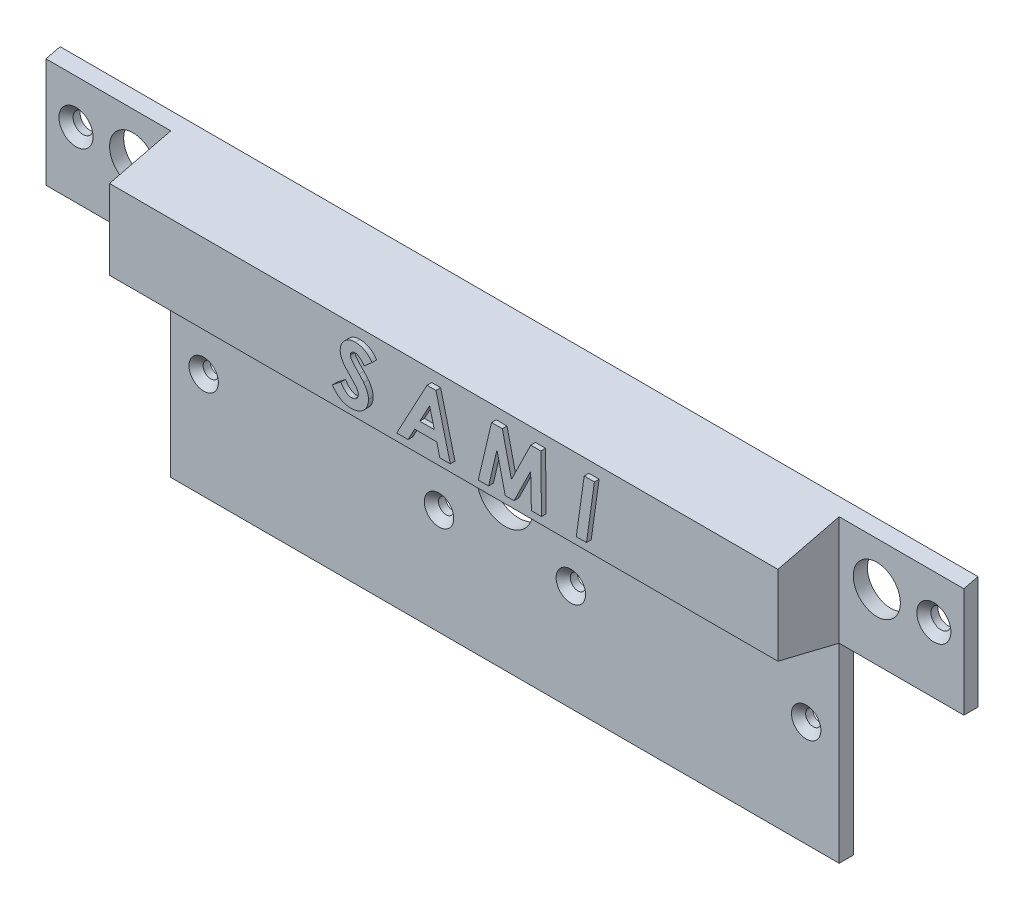
from build123d import *

# Parameters (mm, degrees)
CROQUIS1_R                 = 2.125
CROQUIS1_R_2               = 1.625
SALIENTE_EXTRUIR1_DEPTH    = 3
CROQUIS2_W                 = 142
CROQUIS2_H                 = 24
SALIENTE_EXTRUIR2_DEPTH    = 13
CORTAR_EXTRUIR1_START      = -4
CORTAR_EXTRUIR1_DEPTH      = 134
CORTAR_EXTRUIR2_DEPTH      = 182.852962582
CORTAR_EXTRUIR2_DEPTH_BACK = 182.852962582
SALIENTE_EXTRUIR3_DEPTH    = 1
CHAFL_N1_SIZE              = 1.5
CROQUIS7_R                 = 6
CORTAR_EXTRUIR3_DEPTH      = 10
CROQUIS11_R                = 5
CORTAR_EXTRUIR7_DEPTH      = 60


with BuildPart() as part:
    # Croquis1 → Saliente-Extruir1 (new body)
    with BuildSketch(Plane.XY):
        Polygon((-97.5, -2), (-97.5, -26), (-71, -26), (-71, -66.5), (71, -66.5), (71, -26), (97.5, -26), (97.5, -2), align=None)
        with Locations((-91.125, -12.1)):
            Circle(CROQUIS1_R, mode=Mode.SUBTRACT)
        with Locations((-64, -44)):
            Circle(CROQUIS1_R_2, mode=Mode.SUBTRACT)
        with Locations((-14, -44)):
            Circle(CROQUIS1_R_2, mode=Mode.SUBTRACT)
        with Locations((14, -44)):
            Circle(CROQUIS1_R_2, mode=Mode.SUBTRACT)
        with Locations((64, -44)):
            Circle(CROQUIS1_R_2, mode=Mode.SUBTRACT)
        with Locations((91.125, -12.1)):
            Circle(CROQUIS1_R, mode=Mode.SUBTRACT)
    extrude(amount=SALIENTE_EXTRUIR1_DEPTH)

    # Croquis2 → Saliente-Extruir2 (add)
    with BuildSketch(Plane.XY.offset(3)):
        with Locations((0, -14)):
            Rectangle(CROQUIS2_W, CROQUIS2_H)
    extrude(amount=SALIENTE_EXTRUIR2_DEPTH)

    # Croquis4 → Cortar-Extruir1 (cut)
    with BuildSketch(Plane.ZY.offset(71).offset(CORTAR_EXTRUIR1_START)):
        Polygon((0, -23), (12.254442441, -20), (12.254442441, -8), (0, -5), align=None)
    extrude(amount=-CORTAR_EXTRUIR1_DEPTH, mode=Mode.SUBTRACT)

    # Croquis5 → Cortar-Extruir2 (cut, two sides: drawn at the far end of the back side and taken through both)
    with BuildSketch(Plane.ZY.offset(71).offset(-CORTAR_EXTRUIR2_DEPTH_BACK)):
        Polygon((3, -26), (16, -22.817480666), (16, -5.916946873), (0, -2), (13.126652557, 3.411104472), (22.490929508, -3.111277484), (22.490929508, -28.482984682), align=None)
    extrude(amount=CORTAR_EXTRUIR2_DEPTH + CORTAR_EXTRUIR2_DEPTH_BACK, mode=Mode.SUBTRACT)

    # Croquis6 → Saliente-Extruir3 (add)
    # profile 1 of 4: a face of its own
    with BuildSketch(Plane.XY.offset(16)):
        with BuildLine():
            Line((-14.237980769, -9.985749897), (-15.90625, -11.44007682))
            add(Edge.make_bspline(
                [(-15.90625, -11.44007682), (-15.989626138, -11.327448514), (-16.149414971, -11.111598441), (-16.40296706, -10.822085331), (-16.645879271, -10.570501926), (-16.890561991, -10.369874968), (-17.129057977, -10.210789404), (-17.363445534, -10.095551079), (-17.595042177, -10.022729498), (-17.749526692, -10.014017491), (-17.824519231, -10.009788358)],
                knots=[0, 0, 0, 0, 1.358515141, 2.603569235, 3.730126198, 4.746094498, 5.666493297, 6.504166865, 7.273866877, 8, 8, 8, 8], degree=3))
            add(Edge.make_bspline(
                [(-17.824519231, -10.009788358), (-17.895356089, -10.012855098), (-18.031584807, -10.018752848), (-18.22713207, -10.069034852), (-18.404858991, -10.149916554), (-18.557444672, -10.266921908), (-18.684884048, -10.401824243), (-18.779509513, -10.553209832), (-18.834618158, -10.720070113), (-18.842257012, -10.835512647), (-18.846153846, -10.894403743)],
                knots=[0, 0, 0, 0, 1.130304997, 2.173727141, 3.204821236, 4.229135679, 5.225705988, 6.15679035, 7.05971714, 8, 8, 8, 8], degree=3))
            add(Edge.make_bspline(
                [(-18.846153846, -10.894403743), (-18.842604913, -10.952419762), (-18.835140436, -11.074444962), (-18.780451752, -11.259433313), (-18.697727885, -11.454346792), (-18.598228785, -11.623824314), (-18.486512728, -11.77771519), (-18.369441299, -11.928296257), (-18.21657709, -12.108334434), (-18.030567158, -12.319891013), (-17.813188546, -12.564750981), (-17.558803159, -12.839351591), (-17.271991311, -13.145496303), (-17.068274685, -13.359303629), (-16.961538462, -13.47132682)],
                knots=[0, 0, 0, 0, 0.642317819, 1.35098826, 2.122816345, 2.986294386, 3.520967692, 4.229638134, 5.099348126, 6.137609051, 7.351336444, 8.727500291, 10.285391505, 12, 12, 12, 12], degree=3))
            add(Edge.make_bspline(
                [(-16.961538462, -13.47132682), (-16.903636795, -13.531223219), (-16.792534747, -13.646152772), (-16.636643855, -13.814003622), (-16.497508029, -13.969569485), (-16.369045391, -14.107401891), (-16.259073151, -14.234617568), (-16.165177608, -14.34816442), (-16.085465961, -14.446444683), (-16.0383396, -14.508090166), (-16.016826923, -14.536230666)],
                knots=[0, 0, 0, 0, 1.403722598, 2.693470914, 3.859630393, 4.920438112, 5.867965235, 6.69256451, 7.40316977, 8, 8, 8, 8], degree=3))
            add(Edge.make_bspline(
                [(-16.016826923, -14.536230666), (-15.931162119, -14.654577639), (-15.765940249, -14.88283367), (-15.551635213, -15.229880041), (-15.37438103, -15.564252574), (-15.235094927, -15.88990853), (-15.130899714, -16.210409792), (-15.05543423, -16.531054248), (-15.007896968, -16.854509011), (-15.002624572, -17.072130546), (-15, -17.180461435)],
                knots=[0, 0, 0, 0, 1.215130546, 2.343624586, 3.390252636, 4.360992906, 5.286454858, 6.190345157, 7.099163061, 8, 8, 8, 8], degree=3))
            add(Edge.make_bspline(
                [(-15, -17.180461435), (-15.003265975, -17.300028306), (-15.009693432, -17.535336508), (-15.059498325, -17.880577858), (-15.137073288, -18.211608952), (-15.252749328, -18.52644101), (-15.395580999, -18.828499955), (-15.576864744, -19.11336264), (-15.785408375, -19.385848928), (-16.026160027, -19.639521442), (-16.289666574, -19.871503798), (-16.576596067, -20.072392787), (-16.879880295, -20.243624017), (-17.202602308, -20.384593326), (-17.543778684, -20.491812043), (-17.90280078, -20.568073199), (-18.279005837, -20.61869508), (-18.536688597, -20.622983286), (-18.668269231, -20.625172973)],
                knots=[0, 0, 0, 0, 1.018989505, 2.005376454, 2.968035412, 3.912365187, 4.859556873, 5.811049809, 6.78527381, 7.780773345, 8.787785161, 9.773320145, 10.761314359, 11.752515283, 12.770107012, 13.804505292, 14.878913802, 16, 16, 16, 16], degree=3))
            add(Edge.make_bspline(
                [(-18.668269231, -20.625172973), (-18.769284127, -20.62314894), (-18.969252502, -20.619142179), (-19.265642237, -20.592539289), (-19.554845581, -20.547124694), (-19.836437535, -20.481588061), (-20.111006069, -20.399756263), (-20.378979241, -20.301531223), (-20.639686545, -20.182641261), (-20.893461855, -20.046177875), (-21.140328633, -19.891607359), (-21.378805584, -19.717085991), (-21.611465717, -19.525979253), (-21.835259605, -19.314667737), (-22.054912323, -19.088984376), (-22.266576688, -18.843795132), (-22.468125847, -18.578072355), (-22.596069502, -18.392506783), (-22.661057692, -18.298249897)],
                knots=[0, 0, 0, 0, 1.003438088, 1.986398949, 2.953471805, 3.909242729, 4.856156023, 5.798037682, 6.742035895, 7.700024963, 8.658509928, 9.632892881, 10.633707184, 11.647385023, 12.688779161, 13.761077638, 14.862753205, 16, 16, 16, 16], degree=3))
            Line((-22.661057692, -18.298249897), (-20.884615385, -16.901615281))
            add(Edge.make_bspline(
                [(-20.884615385, -16.901615281), (-20.796133427, -17.037667664), (-20.626430657, -17.298607485), (-20.34982297, -17.650830005), (-20.067822589, -17.950179859), (-19.779405576, -18.195493135), (-19.483644037, -18.386365741), (-19.182661042, -18.522803011), (-18.875117063, -18.610559253), (-18.666427793, -18.620314724), (-18.5625, -18.625172973)],
                knots=[0, 0, 0, 0, 1.289844872, 2.473840458, 3.555310637, 4.554525788, 5.477014656, 6.343795492, 7.175205895, 8, 8, 8, 8], degree=3))
            add(Edge.make_bspline(
                [(-18.5625, -18.625172973), (-18.466608696, -18.620970508), (-18.279938128, -18.612789613), (-18.012906753, -18.536619842), (-17.767915589, -18.419199206), (-17.555817127, -18.251540983), (-17.377139034, -18.054637597), (-17.24725602, -17.83032248), (-17.169063266, -17.584546429), (-17.158994702, -17.414201651), (-17.153846154, -17.32709605)],
                knots=[0, 0, 0, 0, 1.07813582, 2.098795369, 3.104167493, 4.120866408, 5.124778177, 6.083335831, 7.019916046, 8, 8, 8, 8], degree=3))
            add(Edge.make_bspline(
                [(-17.153846154, -17.32709605), (-17.156305742, -17.256296592), (-17.161308997, -17.11227744), (-17.213463163, -16.897776687), (-17.290868572, -16.680273894), (-17.384686199, -16.496451163), (-17.485874595, -16.335262812), (-17.593034102, -16.189295342), (-17.727871488, -16.01796368), (-17.894684288, -15.825289294), (-18.086653682, -15.6047675), (-18.311053405, -15.364148452), (-18.560713769, -15.095469359), (-18.739972106, -14.911640288), (-18.834134615, -14.81507682)],
                knots=[0, 0, 0, 0, 0.82235112, 1.672813781, 2.554588539, 3.50524042, 4.06657461, 4.767804758, 5.610876414, 6.602916144, 7.732569792, 9.01260869, 10.430754915, 12, 12, 12, 12], degree=3))
            add(Edge.make_bspline(
                [(-18.834134615, -14.81507682), (-18.933796083, -14.712000384), (-19.126457636, -14.512737151), (-19.399022138, -14.221116735), (-19.644537968, -13.949692255), (-19.862727128, -13.698178106), (-20.053769849, -13.466122167), (-20.220971836, -13.255284863), (-20.359272385, -13.062884941), (-20.43727304, -12.93805128), (-20.473557692, -12.879980666)],
                knots=[0, 0, 0, 0, 1.354401886, 2.618275412, 3.770529779, 4.811580489, 5.763301005, 6.60974666, 7.35327647, 8, 8, 8, 8], degree=3))
            add(Edge.make_bspline(
                [(-20.473557692, -12.879980666), (-20.554574406, -12.735277508), (-20.711760817, -12.454528401), (-20.873808353, -12.012655576), (-20.979408373, -11.576459651), (-20.993212918, -11.285199559), (-21, -11.141999897)],
                knots=[0, 0, 0, 0, 1.081804801, 2.098888081, 3.065307629, 4, 4, 4, 4], degree=3))
            add(Edge.make_bspline(
                [(-21, -11.141999897), (-20.997562984, -11.049741664), (-20.992715305, -10.866222803), (-20.957815751, -10.595373109), (-20.904379157, -10.330523561), (-20.819192416, -10.075691466), (-20.720947532, -9.824495817), (-20.592529271, -9.583537033), (-20.448250884, -9.34633255), (-20.332500788, -9.199389859), (-20.274038462, -9.125172973)],
                knots=[0, 0, 0, 0, 1.012167245, 2.013389743, 2.992947912, 3.971795425, 4.958040075, 5.949133471, 6.964161297, 8, 8, 8, 8], degree=3))
            add(Edge.make_bspline(
                [(-20.274038462, -9.125172973), (-20.196863127, -9.035727326), (-20.044645553, -8.859308275), (-19.781280254, -8.633794587), (-19.502039805, -8.439002065), (-19.200913405, -8.282622933), (-18.881363751, -8.157986947), (-18.54035169, -8.073413083), (-18.180490688, -8.018161336), (-17.933706603, -8.012618614), (-17.807692308, -8.009788358)],
                knots=[0, 0, 0, 0, 1.010152455, 1.992384693, 2.959065588, 3.919519142, 4.890305168, 5.888624478, 6.921877408, 8, 8, 8, 8], degree=3))
            add(Edge.make_bspline(
                [(-17.807692308, -8.009788358), (-17.633433825, -8.01587198), (-17.289683468, -8.027872813), (-16.783975681, -8.121148963), (-16.302065667, -8.279260008), (-15.839133772, -8.494079527), (-15.402696524, -8.776984417), (-14.986925157, -9.11896429), (-14.592049103, -9.522456693), (-14.358202489, -9.828441546), (-14.237980769, -9.985749897)],
                knots=[0, 0, 0, 0, 0.984438778, 1.941949542, 2.894274057, 3.844399604, 4.817935388, 5.825099055, 6.88187249, 8, 8, 8, 8], degree=3))
        make_face()
    # profile 2 of 4: a face of its own
    with BuildSketch(Plane.XY.offset(16)):
        Polygon((-2.550480769, -8.317480666), (-0.661057692, -8.317480666), (2.384615385, -20.317480666), (0.168269231, -20.317480666), (-0.495192308, -17.70209605), (-5.173076923, -17.70209605), (-6.576923077, -20.317480666), (-9, -20.317480666), align=None)
        Polygon((-1.007211538, -15.70209605), (-1.997596154, -11.79584605), (-4.096153846, -15.70209605), align=None, mode=Mode.SUBTRACT)
    # profile 3 of 4: a face of its own
    with BuildSketch(Plane.XY.offset(16)):
        Polygon((11.149038462, -8.317480666), (13.439903846, -8.317480666), (15.384615385, -16.678057589), (19.490384615, -8.317480666), (21.615384615, -8.317480666), (21.769230769, -20.317480666), (19.615384615, -20.317480666), (19.461538462, -13.13959605), (15.9375, -20.317480666), (14.060096154, -20.317480666), (12.307692308, -12.779019127), (10.536057692, -20.317480666), (8.329326923, -20.317480666), align=None)
    # profile 4 of 4: a face of its own
    with BuildSketch(Plane.XY.offset(16)):
        Polygon((30.836538462, -8.317480666), (33.009615385, -8.317480666), (31.326923077, -20.317480666), (29.153846154, -20.317480666), align=None)
    extrude(amount=SALIENTE_EXTRUIR3_DEPTH)

    # Chaflán1
    chafl_n1_edges = [part.edges().sort_by_distance(p)[0] for p in [
        (-93.25, -12.1, 3),
        (89, -12.1, 3),
        (62.375, -44, 3),
        (12.375, -44, 3),
        (-15.625, -44, 3),
        (-65.625, -44, 3),
    ]]
    chamfer(chafl_n1_edges, length=CHAFL_N1_SIZE)

    # Croquis7 → Cortar-Extruir3 (cut)
    with BuildSketch(Plane.XY.offset(3)):
        with Locations((0, -34)):
            Circle(CROQUIS7_R)
    extrude(amount=-CORTAR_EXTRUIR3_DEPTH, mode=Mode.SUBTRACT)

    # Croquis11 → Cortar-Extruir7 (cut)
    with BuildSketch(Plane.XY.offset(3)):
        with Locations((-79, -12.1)):
            Circle(CROQUIS11_R)
        with Locations((79, -12.1)):
            Circle(CROQUIS11_R)
    extrude(amount=-CORTAR_EXTRUIR7_DEPTH, mode=Mode.SUBTRACT)


solid = part.part
